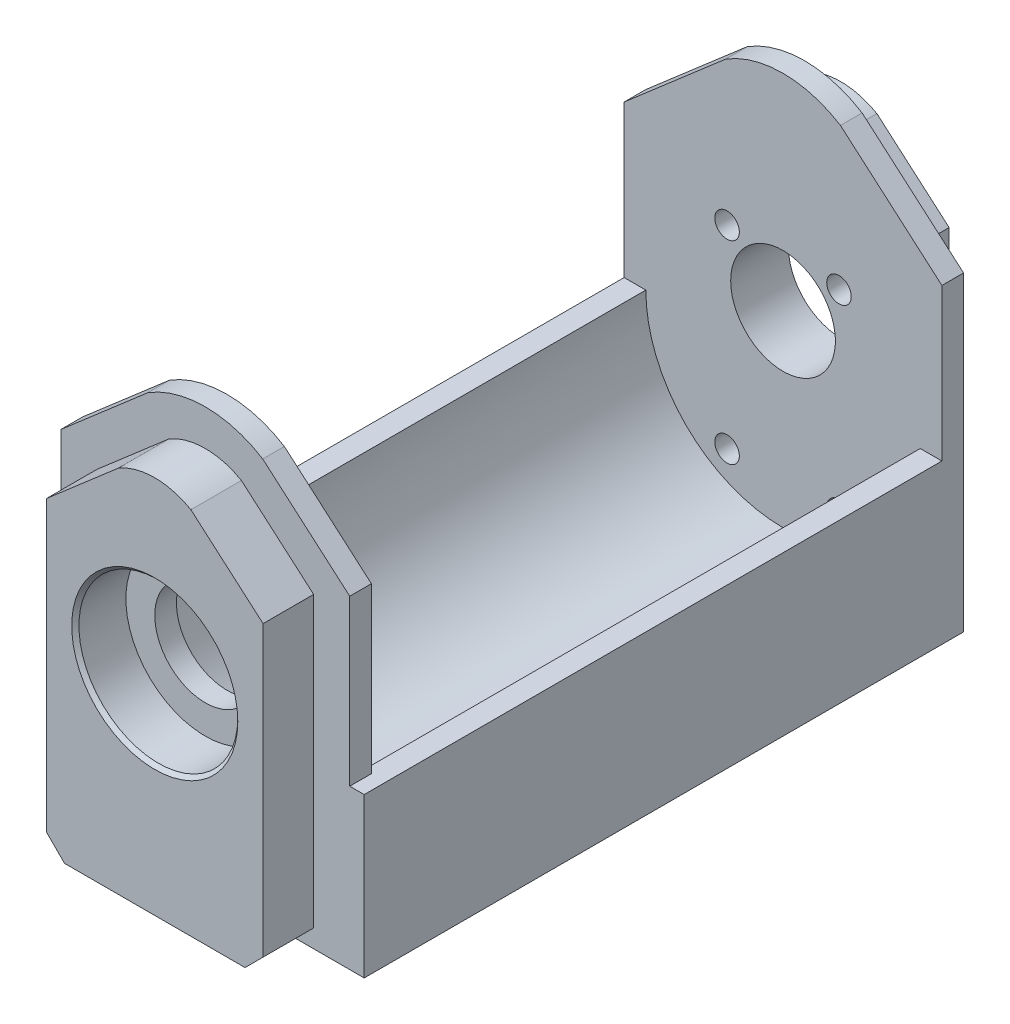
from build123d import *

# Parameters (mm, degrees)
SKETCH3_R                      = 7.25
BOSS_EXTRUDE1_DEPTH            = 5
BOSS_EXTRUDE2_DEPTH            = 80
BOSS_EXTRUDE3_DEPTH            = 10
SKETCH16_R                     = 11
CUT_EXTRUDE1_DEPTH             = 7
CUT_EXTRUDE2_REACH             = 97.699
SKETCH17_R                     = 7
CHAMFER2_SIZE                  = 0.5
CHAMFER3_SIZE                  = 0.5
BOSS_EXTRUDE7_DEPTH            = 3
CUT_EXTRUDE7_DEPTH             = 7
SKETCH3_6_R                    = 7.25
CUT_EXTRUDE6_DEPTH             = 5
BOSS_EXTRUDE8_START            = -5
BOSS_EXTRUDE8_OUTLINE_R        = 7.25
BOSS_EXTRUDE8_DEPTH            = 5
SKETCH24_R                     = 7.25
BOSS_EXTRUDE12_DEPTH           = 3
M3_CLEARANCE_HOLE1_D           = 3.4
M3_CLEARANCE_HOLE1_DEPTH       = 10
M3_CLEARANCE_HOLE1_CSINK_D     = 3.45
M3_CLEARANCE_HOLE1_CSINK_ANGLE = 90
M3_CLEARANCE_HOLE1_TIP         = 1.021463052
CUT_EXTRUDE8_DEPTH             = 5


# Read off the part's stored shape, not the designer's step: Boss-Extrude8
with BuildPart() as part:
    # Sketch3 → Boss-Extrude1 (new body)
    with BuildSketch(Plane.XY):
        with BuildLine():
            Line((22, 0), (22, -22))
            Line((22, -22), (-22, -22))
            Line((-22, -22), (-22, 0))
            ThreePointArc((-22, 0), (0, 22), (22, 0))
        make_face()
        with Locations((0, 7)):
            Circle(SKETCH3_R, mode=Mode.SUBTRACT)
    extrude(amount=BOSS_EXTRUDE1_DEPTH)

    # Sketch7 → Boss-Extrude2 (add)
    with BuildSketch(Plane.XY.offset(5)):
        with BuildLine():
            Line((-19, 0), (-22, 0))
            Line((-22, 0), (-22, -22))
            Line((-22, -22), (22, -22))
            Line((22, -22), (22, 0))
            Line((22, 0), (19, 0))
            ThreePointArc((19, 0), (0, -19), (-19, 0))
        make_face()
    extrude(amount=BOSS_EXTRUDE2_DEPTH)

    # Sketch9 → Boss-Extrude3 (add)
    with BuildSketch(Plane.XY.offset(85)):
        with BuildLine():
            Line((-15, 20.5), (-15, -22))
            Line((-15, -22), (15, -22))
            Line((15, -22), (15, 20.5))
            Line((15, 20.5), (5, 29.160254038))
            ThreePointArc((5, 29.160254038), (0, 30.5), (-5, 29.160254038))
            Line((-5, 29.160254038), (-15, 20.5))
        make_face()
    extrude(amount=BOSS_EXTRUDE3_DEPTH)

    # Sketch16 → Cut-Extrude1 (cut)
    with BuildSketch(Plane.XY.offset(95)):
        with Locations((0, 7)):
            Circle(SKETCH16_R)
    extrude(amount=-CUT_EXTRUDE1_DEPTH, mode=Mode.SUBTRACT)

    # Sketch17 → Cut-Extrude2 (cut, up to next)
    with BuildSketch(Plane.XY.offset(88), mode=Mode.PRIVATE) as cut_extrude2_sk1:
        with Locations((0, 7)):
            Circle(SKETCH17_R)
    cut_extrude2_tool1 = extrude(cut_extrude2_sk1.sketch, amount=-CUT_EXTRUDE2_REACH, mode=Mode.PRIVATE) & part.part
    add(cut_extrude2_tool1.solids().sort_by_distance((0, 7, 88))[0], mode=Mode.SUBTRACT)

    # Chamfer2
    chamfer2_edges = [part.edges().sort_by_distance(p)[0] for p in [
        (-11, 7, 95),
    ]]
    chamfer(chamfer2_edges, length=CHAMFER2_SIZE)

    # Chamfer3
    chamfer3_edges = [part.edges().sort_by_distance(p)[0] for p in [
        (-7.25, 7, 5),
    ]]
    chamfer(chamfer3_edges, length=CHAMFER3_SIZE)

    # Sketch22 → Boss-Extrude7 (add)
    with BuildSketch(Plane(origin=(0, 0, 85), x_dir=(-1, 0, 0), z_dir=(0, 0, -1))):
        with BuildLine():
            Line((-20, 22.784251259), (-20, 0))
            Line((-20, 0), (-20, -11.66190379))
            Line((-20, -11.66190379), (-20, -22))
            Line((-20, -22), (-15, -22))
            Line((-15, -22), (-15, -11.66190379))
            Line((-15, -11.66190379), (-15, 20.5))
            Line((-15, 20.5), (-5, 29.160254038))
            ThreePointArc((-5, 29.160254038), (0, 30.5), (5, 29.160254038))
            Line((5, 29.160254038), (15, 20.5))
            Line((15, 20.5), (15, -11.66190379))
            Line((15, -11.66190379), (15, -22))
            Line((15, -22), (20, -22))
            Line((20, -22), (20, -11.66190379))
            Line((20, -11.66190379), (20, 0))
            Line((20, 0), (20, 22.784251259))
            Line((20, 22.784251259), (7.949555075, 33.220242691))
            ThreePointArc((7.949555075, 33.220242691), (0, 35.5), (-7.949555075, 33.220242691))
            Line((-7.949555075, 33.220242691), (-20, 22.784251259))
        make_face()
        Polygon((22, 0), (20, 0), (20, -11.66190379), (20, -22), (22, -22), align=None)
        Polygon((-20, -11.66190379), (-20, 0), (-22, 0), (-22, -22), (-20, -22), align=None)
    extrude(amount=-BOSS_EXTRUDE7_DEPTH)

    # Sketch25 → Cut-Extrude7 (cut)
    with BuildSketch(Plane.XY.offset(95)):
        Polygon((-15, -19.5), (-12.5, -22), (-15, -22), align=None)
        Polygon((15, -19.5), (12.5, -22), (15, -22), align=None)
    extrude(amount=-CUT_EXTRUDE7_DEPTH, mode=Mode.SUBTRACT)

    # Sketch3<6> → Cut-Extrude6 (cut)
    # profile 1 of 3: a face of its own
    with BuildSketch(Plane.XY):
        with BuildLine():
            ThreePointArc((0, -22), (15.556349186, -15.556349186), (22, 0))
            ThreePointArc((22, 0), (0, 22), (-22, 0))
            ThreePointArc((-22, 0), (-15.556349186, -15.556349186), (0, -22))
        make_face()
        with Locations((0, 7)):
            Circle(SKETCH3_6_R, mode=Mode.SUBTRACT)
    # profile 2 of 3: a face of its own
    with BuildSketch(Plane.XY):
        with BuildLine():
            ThreePointArc((0, -22), (-15.556349186, -15.556349186), (-22, 0))
            Line((-22, 0), (-22, -22))
            Line((-22, -22), (0, -22))
        make_face()
    # profile 3 of 3: a face of its own
    with BuildSketch(Plane.XY):
        with BuildLine():
            Line((22, -22), (22, 0))
            ThreePointArc((22, 0), (15.556349186, -15.556349186), (0, -22))
            Line((0, -22), (22, -22))
        make_face()
    extrude(amount=CUT_EXTRUDE6_DEPTH, mode=Mode.SUBTRACT)

    # Boss-Extrude8 outline → Boss-Extrude8 (add)
    with BuildSketch(Plane(origin=(0, 0, 0), x_dir=(-1, 0, 0), z_dir=(0, 0, -1)).offset(BOSS_EXTRUDE8_START)):
        with BuildLine():
            Line((15, 20.5), (5, 29.160254038))
            ThreePointArc((5, 29.160254038), (0, 30.5), (-5, 29.160254038))
            Line((-5, 29.160254038), (-15, 20.5))
            Line((-15, 20.5), (-15, -22))
            Line((-15, -22), (15, -22))
            Line((15, -22), (15, 20.5))
        make_face()
        with Locations((0, 7)):
            Circle(BOSS_EXTRUDE8_OUTLINE_R, mode=Mode.SUBTRACT)
    extrude(amount=BOSS_EXTRUDE8_DEPTH)

    # Sketch24 → Boss-Extrude12 (add)
    with BuildSketch(Plane(origin=(0, 0, 5), x_dir=(-1, 0, 0), z_dir=(0, 0, -1))):
        with BuildLine():
            Line((-7.949555075, 33.220242691), (-20, 22.784251259))
            Line((-20, 22.784251259), (-22, 21.052200451))
            Line((-22, 21.052200451), (-22, 0))
            Line((-22, 0), (-22, -22))
            Line((-22, -22), (22, -22))
            Line((22, -22), (22, 0))
            Line((22, 0), (22, 21.052200451))
            Line((22, 21.052200451), (20, 22.784251259))
            Line((20, 22.784251259), (7.949555075, 33.220242691))
            ThreePointArc((7.949555075, 33.220242691), (0, 35.5), (-7.949555075, 33.220242691))
        make_face()
        with Locations((0, 7)):
            Circle(SKETCH24_R, mode=Mode.SUBTRACT)
    extrude(amount=-BOSS_EXTRUDE12_DEPTH)

    # M3 Clearance Hole1
    with Locations(Plane(origin=(0, 0, 0), x_dir=(-1, 0, 0), z_dir=(0, 0, -1))):
        with Locations((7.75, 13.423393759), (-7.75, 13.423393759), (-7.75, -13.423393759), (7.75, -13.423393759)):
            CounterSinkHole(M3_CLEARANCE_HOLE1_D / 2, M3_CLEARANCE_HOLE1_CSINK_D / 2, depth=M3_CLEARANCE_HOLE1_DEPTH, counter_sink_angle=M3_CLEARANCE_HOLE1_CSINK_ANGLE)
            with Locations((0, 0, -(M3_CLEARANCE_HOLE1_DEPTH + M3_CLEARANCE_HOLE1_TIP / 2))):  # 118° drill point
                Cone(0, M3_CLEARANCE_HOLE1_D / 2, M3_CLEARANCE_HOLE1_TIP, mode=Mode.SUBTRACT)

    # Sketch26 → Cut-Extrude8 (cut)
    with BuildSketch(Plane(origin=(0, 0, 0), x_dir=(-1, 0, 0), z_dir=(0, 0, -1))):
        Polygon((-15, -19.5), (-12.5, -22), (-15, -22), align=None)
        Polygon((15, -19.5), (12.5, -22), (15, -22), align=None)
    extrude(amount=-CUT_EXTRUDE8_DEPTH, mode=Mode.SUBTRACT)


solid = part.part
